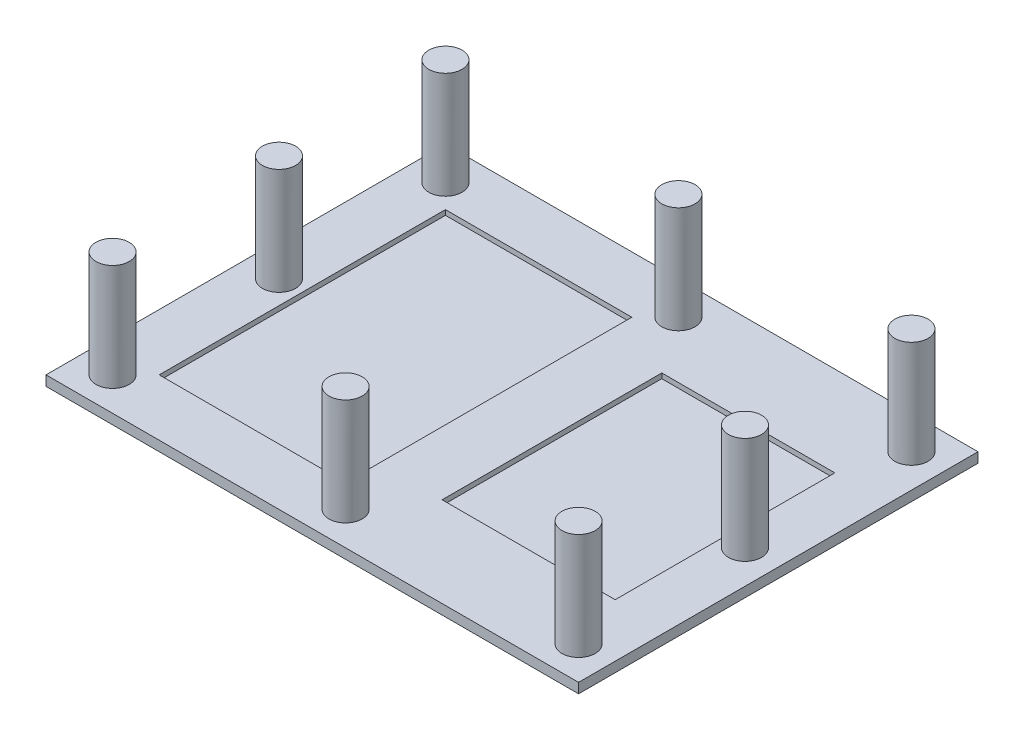
from build123d import *

# Parameters (mm, degrees)
SKETCH1_W           = 160
SKETCH1_H           = 120
BOSS_EXTRUDE1_DEPTH = 3
SKETCH2_R           = 5
BOSS_EXTRUDE2_DEPTH = 32
SKETCH3_W           = 56
SKETCH3_H           = 86
CUT_EXTRUDE1_DEPTH  = 1.5
SKETCH5_W           = 52
SKETCH5_H           = 66
CUT_EXTRUDE2_DEPTH  = 1.5


with BuildPart() as part:
    # Sketch1 → Boss-Extrude1 (new body)
    with BuildSketch(Plane(origin=(0, 0, 0), x_dir=(1, 0, 0), z_dir=(0, 1, 0))):
        Rectangle(SKETCH1_W, SKETCH1_H)
    extrude(amount=BOSS_EXTRUDE1_DEPTH)

    # Sketch2 → Boss-Extrude2 (add)
    with BuildSketch(Plane(origin=(0, 3, 0), x_dir=(1, 0, 0), z_dir=(0, 1, 0))):
        with Locations((-70, 50)):
            Circle(SKETCH2_R)
        with Locations((0, 50)):
            Circle(SKETCH2_R)
        with Locations((70, 50)):
            Circle(SKETCH2_R)
        with Locations((-70, 0)):
            Circle(SKETCH2_R)
        with Locations((70, 0)):
            Circle(SKETCH2_R)
        with Locations((-70, -50)):
            Circle(SKETCH2_R)
        with Locations((0, -50)):
            Circle(SKETCH2_R)
        with Locations((70, -50)):
            Circle(SKETCH2_R)
    extrude(amount=BOSS_EXTRUDE2_DEPTH)

    # Sketch3 → Cut-Extrude1 (cut)
    with BuildSketch(Plane(origin=(0, 3, 0), x_dir=(1, 0, 0), z_dir=(0, 1, 0))):
        with Locations((-35, 0)):
            Rectangle(SKETCH3_W, SKETCH3_H)
    extrude(amount=-CUT_EXTRUDE1_DEPTH, mode=Mode.SUBTRACT)

    # Sketch5 → Cut-Extrude2 (cut)
    with BuildSketch(Plane(origin=(0, 3, 0), x_dir=(1, 0, 0), z_dir=(0, 1, 0))):
        with Locations((38, 0)):
            Rectangle(SKETCH5_W, SKETCH5_H)
    extrude(amount=-CUT_EXTRUDE2_DEPTH, mode=Mode.SUBTRACT)


solid = part.part
